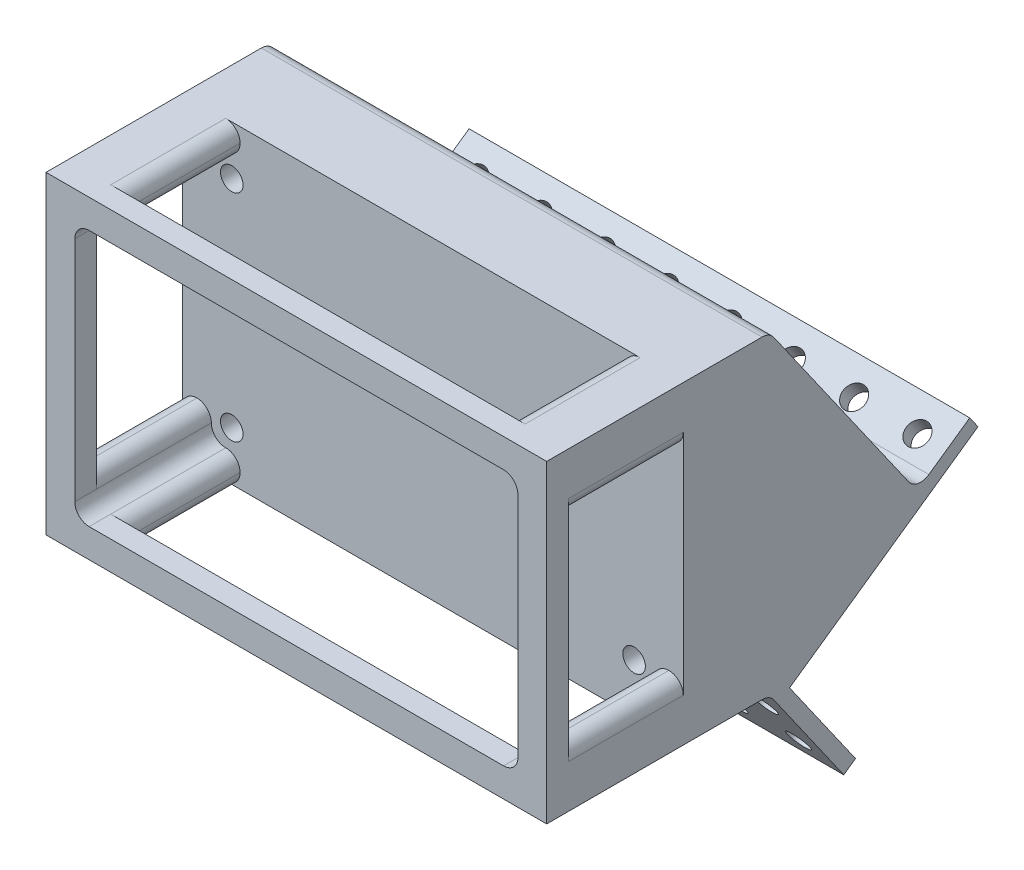
from build123d import *

# Parameters (mm, degrees)
SKETCH1_W               = 110.5662
SKETCH1_H               = 69.342
BOSS_EXTRUDE1_DEPTH     = 9.525
BOSS_EXTRUDE2_DEPTH     = 34.925
BOSS_EXTRUDE3_START     = 34.925
SKETCH1_5_W             = 85.1662
SKETCH1_5_H             = 6.35
SKETCH1_5_W_2           = 6.35
SKETCH1_5_H_2           = 43.942
BOSS_EXTRUDE3_DEPTH     = 4.7625
BOSS_EXTRUDE4_START     = -55.2831
BOSS_EXTRUDE4_DEPTH     = 110.5662
CUT_EXTRUDE3_DEPTH      = 98.551022627
CUT_EXTRUDE3_DEPTH_BACK = 98.551022627
SKETCH1_6_R             = 2.4892
CUT_EXTRUDE1_DEPTH      = 100.785108409
CUT_EXTRUDE1_DEPTH_BACK = 100.785108409
SKETCH3_R               = 2.4892
CUT_EXTRUDE2_DEPTH      = 103.20307776
CUT_EXTRUDE2_DEPTH_BACK = 103.20307776
SKETCH4_R               = 2.4892
FILLET1_R               = 3.175
FILLET2_R               = 3.175


with BuildPart() as part:
    # Sketch1 → Boss-Extrude1 (new, symmetric)
    with BuildSketch(Plane.XY):
        Rectangle(SKETCH1_W, SKETCH1_H)
    extrude(amount=BOSS_EXTRUDE1_DEPTH, both=True)

    # Sketch1<3> → Boss-Extrude2 (add)
    with BuildSketch(Plane.XY):
        Polygon((-55.2831, 21.971), (-48.9331, 21.971), (-48.9331, 28.321), (-42.5831, 28.321), (-42.5831, 34.671), (-55.2831, 34.671), align=None)
        Polygon((48.9331, 28.321), (48.9331, 21.971), (55.2831, 21.971), (55.2831, 34.671), (42.5831, 34.671), (42.5831, 28.321), align=None)
        Polygon((-42.5831, -28.321), (-48.9331, -28.321), (-48.9331, -21.971), (-55.2831, -21.971), (-55.2831, -34.671), (-42.5831, -34.671), align=None)
        Polygon((48.9331, -28.321), (42.5831, -28.321), (42.5831, -34.671), (55.2831, -34.671), (55.2831, -21.971), (48.9331, -21.971), align=None)
    extrude(amount=BOSS_EXTRUDE2_DEPTH)

    # Sketch1<5> → Boss-Extrude3 (add)
    with BuildSketch(Plane.XY.offset(BOSS_EXTRUDE3_START)):
        with Locations((0, 31.496)):
            Rectangle(SKETCH1_5_W, SKETCH1_5_H)
        Polygon((48.9331, 28.321), (48.9331, 21.971), (55.2831, 21.971), (55.2831, 34.671), (42.5831, 34.671), (42.5831, 28.321), align=None)
        with Locations((52.1081, 0)):
            Rectangle(SKETCH1_5_W_2, SKETCH1_5_H_2)
        Polygon((48.9331, -28.321), (42.5831, -28.321), (42.5831, -34.671), (55.2831, -34.671), (55.2831, -21.971), (48.9331, -21.971), align=None)
        with Locations((0, -31.496)):
            Rectangle(SKETCH1_5_W, SKETCH1_5_H)
        Polygon((-42.5831, -28.321), (-48.9331, -28.321), (-48.9331, -21.971), (-55.2831, -21.971), (-55.2831, -34.671), (-42.5831, -34.671), align=None)
        with Locations((-52.1081, 0)):
            Rectangle(SKETCH1_5_W_2, SKETCH1_5_H_2)
        Polygon((-55.2831, 21.971), (-48.9331, 21.971), (-48.9331, 28.321), (-42.5831, 28.321), (-42.5831, 34.671), (-55.2831, 34.671), align=None)
    extrude(amount=BOSS_EXTRUDE3_DEPTH)

    # Sketch2 → Boss-Extrude4 (add)
    with BuildSketch(Plane(origin=(0, 0, 0), x_dir=(0, 0, -1), z_dir=(1, 0, 0)).offset(BOSS_EXTRUDE4_START)):
        Polygon((9.525, 34.671), (9.525, -34.671), (25.914946669, -58.078269666), (28.515754409, -56.25716448), (13.946912926, -35.450702555), (55.559836776, -6.313019589), (53.73873159, -3.712211848), (42.105082855, -11.858180389), align=None)
    extrude(amount=BOSS_EXTRUDE4_DEPTH)

    # Sketch1<6> → Cut-Extrude3 (cut, two sides: drawn at the far end of the back side and taken through both)
    with BuildSketch(Plane.XY.offset(-CUT_EXTRUDE3_DEPTH_BACK)):
        with Locations((-44.4246, 23.8125)):
            Circle(SKETCH1_6_R)
        with Locations((44.4246, 23.8125)):
            Circle(SKETCH1_6_R)
        with Locations((44.4246, -23.8125)):
            Circle(SKETCH1_6_R)
        with Locations((-44.4246, -23.8125)):
            Circle(SKETCH1_6_R)
    extrude(amount=CUT_EXTRUDE3_DEPTH + CUT_EXTRUDE3_DEPTH_BACK, mode=Mode.SUBTRACT)

    # Sketch3 → Cut-Extrude1 (cut, two sides: drawn at the far end of the back side and taken through both)
    with BuildSketch(Plane(origin=(0, -6.931123699, 9.898670495), x_dir=(1, 0, 0), z_dir=(0, -0.5735764363510447, 0.8191520442889929)).offset(-CUT_EXTRUDE1_DEPTH_BACK)):
        with Locations(Location((-48.9331, -56.089136084, 0), (0, 0, 270))):
            Circle(SKETCH3_R)
        with Locations(Location((-34.952214286, -56.089136084, 0), (0, 0, 270))):
            Circle(SKETCH3_R)
        with Locations(Location((-20.971328571, -56.089136084, 0), (0, 0, 270))):
            Circle(SKETCH3_R)
        with Locations(Location((-6.990442857, -56.089136084, 0), (0, 0, 270))):
            Circle(SKETCH3_R)
        with Locations(Location((6.990442857, -56.089136084, 0), (0, 0, 270))):
            Circle(SKETCH3_R)
        with Locations(Location((20.971328571, -56.089136084, 0), (0, 0, 270))):
            Circle(SKETCH3_R)
        with Locations(Location((34.952214286, -56.089136084, 0), (0, 0, 270))):
            Circle(SKETCH3_R)
        with Locations(Location((48.9331, -56.089136084, 0), (0, 0, 270))):
            Circle(SKETCH3_R)
        with Locations(Location((-34.952214286, -43.389136084, 0), (0, 0, 270))):
            Circle(SKETCH3_R)
        with Locations(Location((-20.971328571, -43.389136084, 0), (0, 0, 270))):
            Circle(SKETCH3_R)
        with Locations(Location((-6.990442857, -43.389136084, 0), (0, 0, 270))):
            Circle(SKETCH3_R)
        with Locations(Location((6.990442857, -43.389136084, 0), (0, 0, 270))):
            Circle(SKETCH3_R)
        with Locations(Location((20.971328571, -43.389136084, 0), (0, 0, 270))):
            Circle(SKETCH3_R)
        with Locations(Location((34.952214286, -43.389136084, 0), (0, 0, 270))):
            Circle(SKETCH3_R)
        with Locations(Location((48.9331, -43.389136084, 0), (0, 0, 270))):
            Circle(SKETCH3_R)
        with Locations(Location((-48.9331, -43.389136084, 0), (0, 0, 270))):
            Circle(SKETCH3_R)
    extrude(amount=CUT_EXTRUDE1_DEPTH + CUT_EXTRUDE1_DEPTH_BACK, mode=Mode.SUBTRACT)

    # Sketch4 → Cut-Extrude2 (cut, two sides: drawn at the far end of the back side and taken through both)
    with BuildSketch(Plane(origin=(0, -27.739876301, -19.423670495), x_dir=(1, 0, 0), z_dir=(0, 0.8191520442889928, 0.5735764363510449)).offset(-CUT_EXTRUDE2_DEPTH_BACK)):
        with Locations(Location((48.9331, 35.540954597, 0), (0, 0, 270))):
            Circle(SKETCH4_R)
        with Locations(Location((34.952214286, 35.540954597, 0), (0, 0, 270))):
            Circle(SKETCH4_R)
        with Locations(Location((20.971328571, 35.540954597, 0), (0, 0, 270))):
            Circle(SKETCH4_R)
        with Locations(Location((6.990442857, 35.540954597, 0), (0, 0, 270))):
            Circle(SKETCH4_R)
        with Locations(Location((-6.990442857, 35.540954597, 0), (0, 0, 270))):
            Circle(SKETCH4_R)
        with Locations(Location((-20.971328571, 35.540954597, 0), (0, 0, 270))):
            Circle(SKETCH4_R)
        with Locations(Location((-34.952214286, 35.540954597, 0), (0, 0, 270))):
            Circle(SKETCH4_R)
        with Locations(Location((-48.9331, 35.540954597, 0), (0, 0, 270))):
            Circle(SKETCH4_R)
    extrude(amount=CUT_EXTRUDE2_DEPTH + CUT_EXTRUDE2_DEPTH_BACK, mode=Mode.SUBTRACT)

    # Fillet1
    fillet1_edges = [part.edges().sort_by_distance(p)[0] for p in [
        (0, -11.858180389, -42.105082855),
        (0, 34.671, -9.525),
        (0, -34.671, -9.525),
    ]]
    fillet(fillet1_edges, radius=FILLET1_R)

    # Fillet2
    fillet2_edges = [part.edges().sort_by_distance(p)[0] for p in [
        (48.9331, -28.321, 24.60625),
        (42.5831, -28.321, 22.225),
        (-42.5831, -28.321, 22.225),
        (-48.9331, -28.321, 24.60625),
        (-48.9331, 21.971, 22.225),
        (-48.9331, 28.321, 24.60625),
        (-42.5831, 28.321, 22.225),
        (42.5831, 28.321, 22.225),
        (48.9331, 28.321, 24.60625),
        (48.9331, 21.971, 22.225),
        (48.9331, -21.971, 22.225),
        (-48.9331, -21.971, 22.225),
        (55.2831, 21.971, 22.225),
        (-42.5831, -34.671, 22.225),
        (42.5831, -34.671, 22.225),
        (55.2831, -21.971, 22.225),
        (-55.2831, -21.971, 22.225),
        (-55.2831, 21.971, 22.225),
        (-42.5831, 34.671, 22.225),
        (42.5831, 34.671, 22.225),
    ]]
    fillet(fillet2_edges, radius=FILLET2_R - 0.0001)  # a hair under: the kernel refuses the full size


solid = part.part
